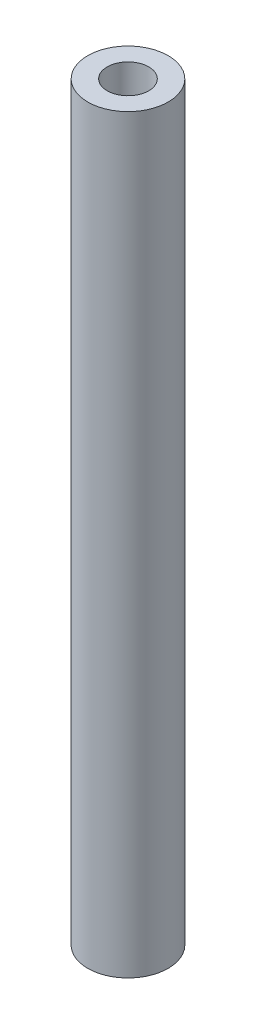
from build123d import *

# Parameters (mm, degrees)
SKETCH1_R           = 3
SKETCH1_R_2         = 1.55
BOSS_EXTRUDE1_DEPTH = 56


with BuildPart() as part:
    # Sketch1 → Boss-Extrude1 (new body)
    with BuildSketch(Plane(origin=(0, 0, 0), x_dir=(1, 0, 0), z_dir=(0, 1, 0))):
        Circle(SKETCH1_R)
        Circle(SKETCH1_R_2, mode=Mode.SUBTRACT)
    extrude(amount=BOSS_EXTRUDE1_DEPTH)


solid = part.part
